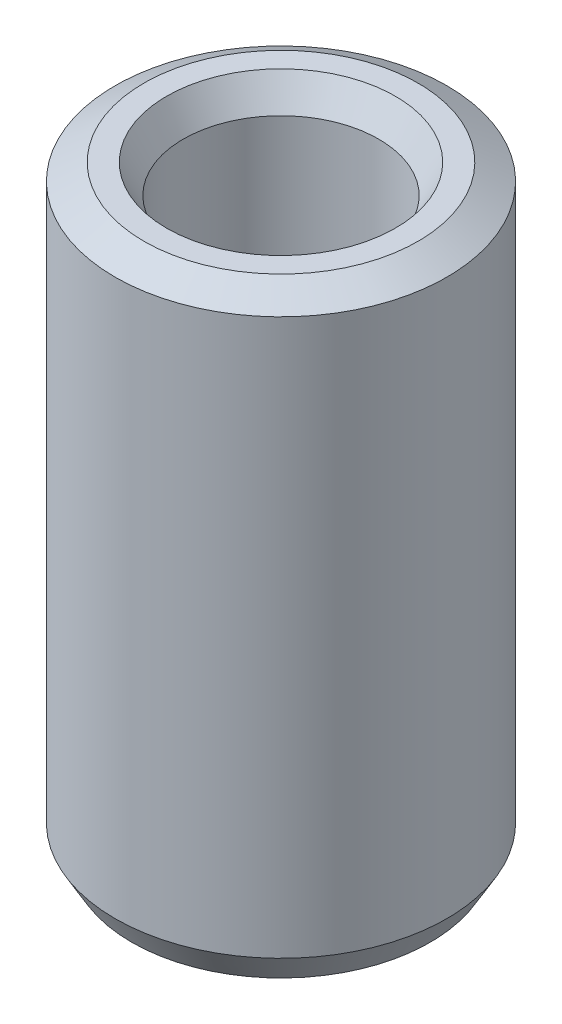
from build123d import *
from OCP.BRepFilletAPI import BRepFilletAPI_MakeChamfer

# Parameters (mm, degrees)
SKETCH1_R           = 37.5
BOSS_EXTRUDE1_DEPTH = 135.869374458
SKETCH2_R           = 22.092242689
CUT_EXTRUDE1_DEPTH  = 146.85262053
CHAMFER1_SIZE       = 3.762610334
CHAMFER1_SIZE2      = 6.517032268


with BuildPart() as part:
    # Sketch1 → Boss-Extrude1 (new body)
    with BuildSketch(Plane(origin=(0, 0, 0), x_dir=(1, 0, 0), z_dir=(0, 1, 0))):
        Circle(SKETCH1_R)
    extrude(amount=BOSS_EXTRUDE1_DEPTH)

    # Sketch2 → Cut-Extrude1 (cut, through all)
    with BuildSketch(Plane(origin=(0, 0, 0), x_dir=(1, 0, 0), z_dir=(0, 1, 0))):
        Circle(SKETCH2_R)
    extrude(amount=CUT_EXTRUDE1_DEPTH, mode=Mode.SUBTRACT)

    # Chamfer1: one chamfer whose edges measure the first distance from different faces: ONE call of the kernel's chamfer builder (chamfer() names one face for all edges)
    chamfer1_edges_1 = [part.edges().sort_by_distance(p)[0] for p in [
        (-22.092242689, 135.869374458, 0),
    ]]
    chamfer1_side_1 = [part.faces().sort_by_distance(p)[0] for p in [
        (-36.439339828, 135.869374458, 0),
    ]]
    chamfer1_edges_2 = [part.edges().sort_by_distance(p)[0] for p in [
        (-22.092242689, 0, 0),
    ]]
    chamfer1_side_2 = [part.faces().sort_by_distance(p)[0] for p in [
        (-22.092242689, 67.934687229, 0),
    ]]
    chamfer1_edges_3 = [part.edges().sort_by_distance(p)[0] for p in [
        (-37.5, 0, 0),
    ]]
    chamfer1_side_3 = [part.faces().sort_by_distance(p)[0] for p in [
        (-36.439339828, 0, 0),
    ]]
    chamfer1_edges_4 = [part.edges().sort_by_distance(p)[0] for p in [
        (-37.5, 135.869374458, 0),
    ]]
    chamfer1_side_4 = [part.faces().sort_by_distance(p)[0] for p in [
        (-37.5, 67.934687229, 0),
    ]]
    chamfer1 = BRepFilletAPI_MakeChamfer(part.part.solid().wrapped)
    for e in chamfer1_edges_1:
        chamfer1.Add(CHAMFER1_SIZE, CHAMFER1_SIZE2, e.wrapped, chamfer1_side_1[0].wrapped)  # the first distance lies on this face
    for e in chamfer1_edges_2:
        chamfer1.Add(CHAMFER1_SIZE, CHAMFER1_SIZE2, e.wrapped, chamfer1_side_2[0].wrapped)  # the first distance lies on this face
    for e in chamfer1_edges_3:
        chamfer1.Add(CHAMFER1_SIZE, CHAMFER1_SIZE2, e.wrapped, chamfer1_side_3[0].wrapped)  # the first distance lies on this face
    for e in chamfer1_edges_4:
        chamfer1.Add(CHAMFER1_SIZE, CHAMFER1_SIZE2, e.wrapped, chamfer1_side_4[0].wrapped)  # the first distance lies on this face
    add(Compound.cast(chamfer1.Shape()), mode=Mode.REPLACE)


solid = part.part
